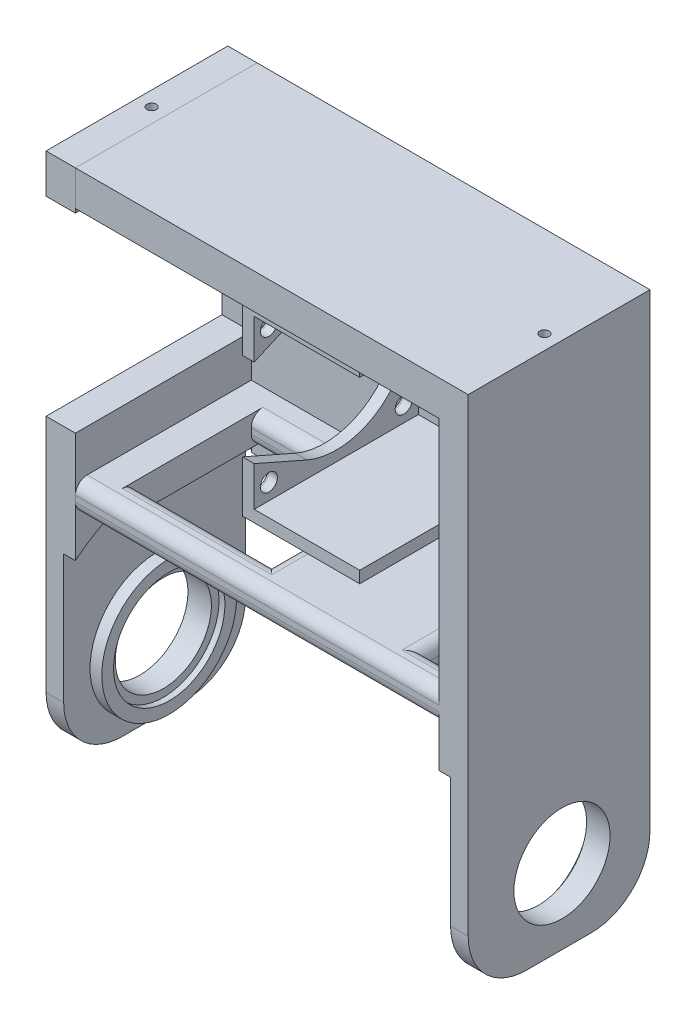
from build123d import *

# Parameters (mm, degrees)
SKETCH1_W                                       = 72
SKETCH1_H                                       = 90
SKETCH1_W_2                                     = 62
SKETCH1_H_2                                     = 88
BOSS_EXTRUDE1_DEPTH                             = 30
SKETCH1_2_W                                     = 72
SKETCH1_2_H                                     = 90
SKETCH1_2_W_2                                   = 62
SKETCH1_2_H_2                                   = 88
BOSS_EXTRUDE2_DEPTH                             = 1
BOSS_EXTRUDE3_DEPTH                             = 28
CUT_EXTRUDE1_DEPTH                              = 28
SKETCH13_W                                      = 30
SKETCH13_H                                      = 32.5
CUT_EXTRUDE6_DEPTH                              = 5
M2_5_CLEARANCE_HOLE1_D                          = 2.9
M2_5_CLEARANCE_HOLE1_DEPTH                      = 2
M2_5_CLEARANCE_HOLE1_TIP                        = 0.871247898
FILLET2_R                                       = 0.5
CUT_EXTRUDE2_DEPTH                              = 87.104587567
CUT_EXTRUDE2_DEPTH_BACK                         = 87.104587567
SKETCH5_R                                       = 8.2
SKETCH5_3_R                                     = 9.5
SKETCH5_3_R_2                                   = 8.2
CUT_EXTRUDE3_DEPTH                              = 1
CUT_EXTRUDE5_DEPTH                              = 65.969223483
CUT_EXTRUDE5_DEPTH_BACK                         = 65.969223483
SKETCH11_W                                      = 62
SKETCH11_H                                      = 42.378459444
SKETCH10_R                                      = 25
SKETCH10_R_2                                    = 11.5
CUT_EXTRUDE4_DEPTH                              = 2
SKETCH12_W                                      = 5
SKETCH12_H                                      = 5
BOSS_EXTRUDE4_DEPTH                             = 62
SKETCH14_W                                      = 26.227821151
SKETCH14_H                                      = 5
SKETCH14_W_2                                    = 5
BOSS_EXTRUDE5_DEPTH                             = 20
FILLET1_R                                       = 2
CHAMFER1_START                                  = -32
CHAMFER1_DEPTH                                  = 64
TAP_DRILL_FOR_M2X0_4_TAP1_D                     = 1.6
TAP_DRILL_FOR_M2X0_4_TAP1_DEPTH                 = 5
TAP_DRILL_FOR_M2X0_4_TAP1_TIP                   = 0.480688495
CSK_FOR_M2_FLAT_HEAD_MACHINE_SCREW1_D           = 1.8
CSK_FOR_M2_FLAT_HEAD_MACHINE_SCREW1_DEPTH       = 20
CSK_FOR_M2_FLAT_HEAD_MACHINE_SCREW1_CSINK_D     = 4.4
CSK_FOR_M2_FLAT_HEAD_MACHINE_SCREW1_CSINK_ANGLE = 90
CSK_FOR_M2_FLAT_HEAD_MACHINE_SCREW1_TIP         = 0.540774557
FILLET3_R                                       = 10


with BuildPart() as part:
    # Sketch1 → Boss-Extrude1 (new body)
    with BuildSketch(Plane.XY):
        Rectangle(SKETCH1_W, SKETCH1_H)
        Rectangle(SKETCH1_W_2, SKETCH1_H_2, mode=Mode.SUBTRACT)
    extrude(amount=BOSS_EXTRUDE1_DEPTH)

    # Sketch1<2> → Boss-Extrude2 (add)
    # profile 1 of 2: a face of its own
    with BuildSketch(Plane.XY):
        Rectangle(SKETCH1_2_W, SKETCH1_2_H)
        Rectangle(SKETCH1_2_W_2, SKETCH1_2_H_2, mode=Mode.SUBTRACT)
    # profile 2 of 2: a face of its own
    with BuildSketch(Plane.XY):
        Rectangle(SKETCH1_2_W_2, SKETCH1_2_H_2)
    extrude(amount=-BOSS_EXTRUDE2_DEPTH)

    # Sketch2 → Boss-Extrude3 (add)
    with BuildSketch(Plane.XY):
        Polygon((15.5, 36.306282193), (15.5, 38.306282193), (-4.5, 38.306282193), (-4.5, 5.806282193), (15.5, 5.806282193), (15.5, 7.806282193), (-2.5, 7.806282193), (-2.5, 36.306282193), align=None)
    extrude(amount=BOSS_EXTRUDE3_DEPTH)

    # Sketch3 → Cut-Extrude1 (cut)
    with BuildSketch(Plane.ZY.offset(4.5)):
        with BuildLine():
            Line((19.030490967, 33.499365721), (28, 29.556282193))
            Line((28, 29.556282193), (28, 14.556282193))
            Line((28, 14.556282193), (19.030490967, 10.613198665))
            ThreePointArc((19.030490967, 10.613198665), (1.5, 22.056282193), (19.030490967, 33.499365721))
        make_face()
    extrude(amount=-CUT_EXTRUDE1_DEPTH, mode=Mode.SUBTRACT)

    # Sketch13 → Cut-Extrude6 (cut)
    with BuildSketch(Plane.ZY.offset(36)):
        with Locations((15, 22.056282193)):
            Rectangle(SKETCH13_W, SKETCH13_H)
    extrude(amount=-CUT_EXTRUDE6_DEPTH, mode=Mode.SUBTRACT)

    # M2.5 Clearance Hole1
    with Locations(Plane.ZY.offset(4.5)):
        with Locations((14, 22.056282193), (2.5, 33.556282193), (25.5, 33.556282193), (25.5, 10.556282193), (2.5, 10.556282193)):
            Hole(M2_5_CLEARANCE_HOLE1_D / 2, depth=M2_5_CLEARANCE_HOLE1_DEPTH)
            with Locations((0, 0, -(M2_5_CLEARANCE_HOLE1_DEPTH + M2_5_CLEARANCE_HOLE1_TIP / 2))):  # 118° drill point
                Cone(0, M2_5_CLEARANCE_HOLE1_D / 2, M2_5_CLEARANCE_HOLE1_TIP, mode=Mode.SUBTRACT)

    # Fillet2
    fillet2_edges = [part.edges().sort_by_distance(p)[0] for p in [
        (-4.5, 10.556282193, 3.95),
        (-4.5, 10.556282193, 26.95),
        (-4.5, 33.556282193, 26.95),
        (-4.5, 33.556282193, 3.95),
    ]]
    fillet(fillet2_edges, radius=FILLET2_R)

    # Sketch5 → Cut-Extrude2 (cut, two sides: drawn at the far end of the back side and taken through both)
    with BuildSketch(Plane.ZY.offset(31).offset(-CUT_EXTRUDE2_DEPTH_BACK)):
        with Locations((14, -32.233452062)):
            Circle(SKETCH5_R)
    extrude(amount=CUT_EXTRUDE2_DEPTH + CUT_EXTRUDE2_DEPTH_BACK, mode=Mode.SUBTRACT)

    # Sketch5<3> → Cut-Extrude3 (cut)
    with BuildSketch(Plane.ZY.offset(31)):
        with Locations((14, -32.233452062)):
            Circle(SKETCH5_3_R)
        with Locations((14, -32.233452062)):
            Circle(SKETCH5_3_R_2, mode=Mode.SUBTRACT)
    cut_extrude3 = extrude(amount=CUT_EXTRUDE3_DEPTH, mode=Mode.SUBTRACT)

    # Sketch11 → Cut-Extrude5 (cut, two sides: drawn at the far end of the back side and taken through both)
    with BuildSketch(Plane.XY.offset(-CUT_EXTRUDE5_DEPTH_BACK)):
        with Locations((0, -33.215158936)):
            Rectangle(SKETCH11_W, SKETCH11_H)
    extrude(amount=CUT_EXTRUDE5_DEPTH + CUT_EXTRUDE5_DEPTH_BACK, mode=Mode.SUBTRACT)

    # Sketch10 → Cut-Extrude4 (cut)
    with BuildSketch(Plane(origin=(-31, 0, 0), x_dir=(0, 0, -1), z_dir=(1, 0, 0))):
        with Locations((-14, -32.233452062)):
            Circle(SKETCH10_R)
        with Locations((-14, -32.233452062)):
            Circle(SKETCH10_R_2, mode=Mode.SUBTRACT)
    cut_extrude4 = extrude(amount=-CUT_EXTRUDE4_DEPTH, mode=Mode.SUBTRACT)

    # Mirror1: Cut-Extrude3, Cut-Extrude4 across plane
    add(cut_extrude3.mirror(Plane.ZY), mode=Mode.SUBTRACT)
    add(cut_extrude4.mirror(Plane.ZY), mode=Mode.SUBTRACT)

    # Sketch12 → Boss-Extrude4 (add)
    with BuildSketch(Plane.ZY.offset(-31)):
        with Locations((2.5, 41.5)):
            Rectangle(SKETCH12_W, SKETCH12_H)
        with Locations((27.5, 41.5)):
            Rectangle(SKETCH12_W, SKETCH12_H)
        with Locations((27.5, -3.866599123)):
            Rectangle(SKETCH12_W, SKETCH12_H)
        with Locations((2.5, -3.866599123)):
            Rectangle(SKETCH12_W, SKETCH12_H)
    extrude(amount=BOSS_EXTRUDE4_DEPTH)

    # Sketch14 → Boss-Extrude5 (add)
    with BuildSketch(Plane.XY.offset(5)):
        with Locations((10.597474937, -3.866599123)):
            Rectangle(SKETCH14_W, SKETCH14_H)
        with Locations((-28.5, -3.866599123)):
            Rectangle(SKETCH14_W_2, SKETCH14_H)
    extrude(amount=BOSS_EXTRUDE5_DEPTH)

    # Fillet1
    fillet1_edges = [part.edges().sort_by_distance(p)[0] for p in [
        (0, 39, 5),
        (0, 39, 25),
        (0, -1.366599123, 30),
        (0, -6.366599123, 30),
        (27.355692757, -1.366599123, 5),
        (27.355692757, -6.366599123, 5),
        (27.355692757, -1.366599123, 25),
        (27.355692757, -6.366599123, 25),
        (-2.516435638, -1.366599123, 15),
        (-2.516435638, -6.366599123, 15),
        (23.711385513, -6.366599123, 15),
        (23.711385513, -1.366599123, 15),
        (-14.258217819, -1.366599123, 25),
        (-14.258217819, -1.366599123, 5),
        (-14.258217819, -6.366599123, 25),
        (-14.258217819, -6.366599123, 5),
    ]]
    fillet(fillet1_edges, radius=FILLET1_R)

    # Chamfer1: read off the stored shape, not the designer's step
    # Chamfer1 outline → Chamfer1 (add)
    with BuildSketch(Plane.YZ.offset(CHAMFER1_START)):
        with BuildLine():
            Line((40.428571429, 25.083370305), (44, 20.291796068))
            Line((44, 20.291796068), (44, 25))
            Line((44, 25), (41, 25))
            ThreePointArc((41, 25), (40.711260836, 25.020952326), (40.428571429, 25.083370305))
        make_face()
        with BuildLine():
            Line((44, 9.708203932), (40.428571429, 4.916629695))
            ThreePointArc((40.428571429, 4.916629695), (40.711260836, 4.979047674), (41, 5))
            Line((41, 5), (44, 5))
            Line((44, 5), (44, 9.708203932))
        make_face()
    extrude(amount=CHAMFER1_DEPTH)

    # Tap Drill for M2x0.4 Tap1
    with Locations(Plane(origin=(0, 45, 0), x_dir=(1, 0, 0), z_dir=(0, 1, 0))):
        with Locations((-33.5, -14.5), (33.5, -14.5)):
            Hole(TAP_DRILL_FOR_M2X0_4_TAP1_D / 2, depth=TAP_DRILL_FOR_M2X0_4_TAP1_DEPTH)
            with Locations((0, 0, -(TAP_DRILL_FOR_M2X0_4_TAP1_DEPTH + TAP_DRILL_FOR_M2X0_4_TAP1_TIP / 2))):  # 118° drill point
                Cone(0, TAP_DRILL_FOR_M2X0_4_TAP1_D / 2, TAP_DRILL_FOR_M2X0_4_TAP1_TIP, mode=Mode.SUBTRACT)

    # CSK for M2 Flat Head Machine Screw1
    with Locations(Plane.ZY.offset(36)):
        with Locations((1.5, 42.5), (27.5, -3.866599123), (1.5, -3.866599123), (27.5, 42.5)):
            CounterSinkHole(CSK_FOR_M2_FLAT_HEAD_MACHINE_SCREW1_D / 2, CSK_FOR_M2_FLAT_HEAD_MACHINE_SCREW1_CSINK_D / 2, depth=CSK_FOR_M2_FLAT_HEAD_MACHINE_SCREW1_DEPTH, counter_sink_angle=CSK_FOR_M2_FLAT_HEAD_MACHINE_SCREW1_CSINK_ANGLE)
            with Locations((0, 0, -(CSK_FOR_M2_FLAT_HEAD_MACHINE_SCREW1_DEPTH + CSK_FOR_M2_FLAT_HEAD_MACHINE_SCREW1_TIP / 2))):  # 118° drill point
                Cone(0, CSK_FOR_M2_FLAT_HEAD_MACHINE_SCREW1_D / 2, CSK_FOR_M2_FLAT_HEAD_MACHINE_SCREW1_TIP, mode=Mode.SUBTRACT)

    # Fillet3
    fillet3_edges = [part.edges().sort_by_distance(p)[0] for p in [
        (-34.5, -45, 30),
        (34.5, -45, -1),
        (34.5, -45, 30),
        (-34.5, -45, -1),
    ]]
    fillet(fillet3_edges, radius=FILLET3_R)


with BuildPart() as body_2:
    # Split1: the piece on the far side of the plane
    add(part.part)
    split(bisect_by=Plane(origin=(-31, 0, 0), x_dir=(0, 0, 1), z_dir=(1, 0, 0)), keep=Keep.BOTTOM)


with BuildPart() as part_1:
    add(part.part)

    # Split1
    split(bisect_by=Plane(origin=(-31, 0, 0), x_dir=(0, 0, 1), z_dir=(1, 0, 0)), keep=Keep.TOP)


solid = Compound([body_2.part, part_1.part])
